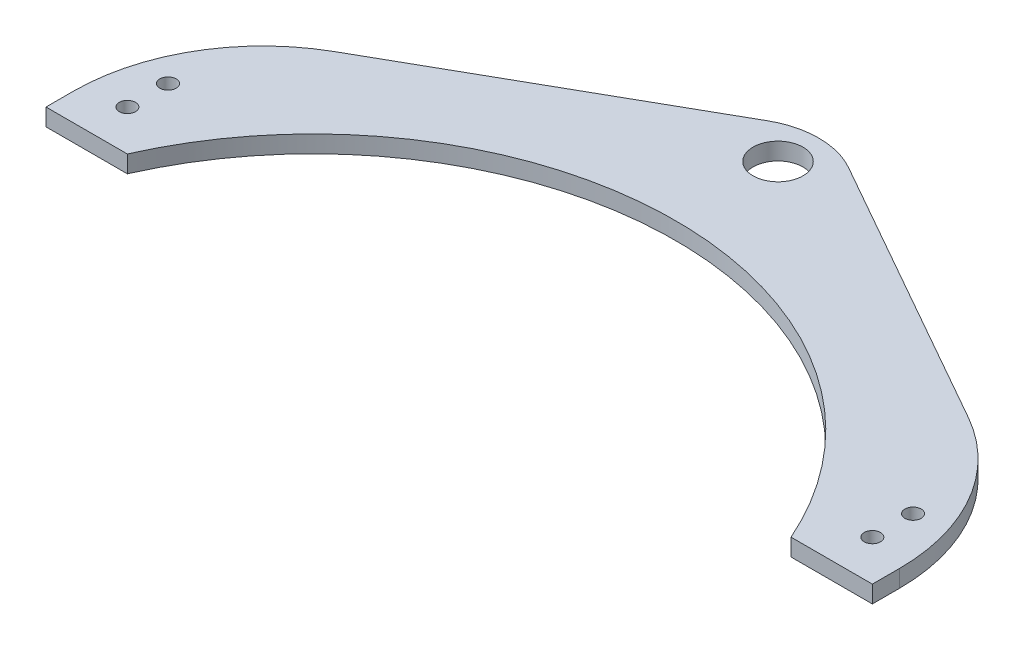
from build123d import *

# Parameters (mm, degrees)
SKETCH1_R           = 4.6
SKETCH1_R_2         = 1.5
BOSS_EXTRUDE2_DEPTH = 3.175


with BuildPart() as part:
    # Sketch1 → Boss-Extrude2 (new body)
    with BuildSketch(Plane(origin=(0, 0, 0), x_dir=(1, 0, 0), z_dir=(0, 1, 0))):
        with BuildLine():
            Line((-7.5, 0), (0, 0))
            ThreePointArc((0, 0), (61.2, 39.907584028), (122.4, 0))
            Line((122.4, 0), (129.9, 0))
            Line((129.9, 0), (137.4, 0))
            Line((137.4, 0), (137.4, 5.001196831))
            ThreePointArc((137.4, 5.001196831), (132.638976527, 22.625166265), (119.651182936, 35.45438529))
            Line((119.651182936, 35.45438529), (68.639886063, 64.351366482))
            ThreePointArc((68.639886063, 64.351366482), (65.069446402, 65.804662996), (61.246521948, 66.3))
            Line((61.246521948, 66.3), (61.153478052, 66.3))
            ThreePointArc((61.153478052, 66.3), (57.330553598, 65.804662996), (53.760113937, 64.351366482))
            Line((53.760113937, 64.351366482), (2.748817064, 35.45438529))
            ThreePointArc((2.748817064, 35.45438529), (-10.238976527, 22.625166265), (-15, 5.001196831))
            Line((-15, 5.001196831), (-15, 0))
            Line((-15, 0), (-7.5, 0))
        make_face()
        with Locations((61.2, 58.8)):
            Circle(SKETCH1_R, mode=Mode.SUBTRACT)
        with BuildLine():
            ThreePointArc((-7.5, 6), (-9, 7.5), (-7.5, 9))
            ThreePointArc((-7.5, 9), (-6, 7.5), (-7.5, 6))
        make_face(mode=Mode.SUBTRACT)
        with Locations((-7.5, 15)):
            Circle(SKETCH1_R_2, mode=Mode.SUBTRACT)
        with BuildLine():
            ThreePointArc((129.9, 6), (128.4, 7.5), (129.9, 9))
            ThreePointArc((129.9, 9), (131.4, 7.5), (129.9, 6))
        make_face(mode=Mode.SUBTRACT)
        with Locations((129.9, 15)):
            Circle(SKETCH1_R_2, mode=Mode.SUBTRACT)
    extrude(amount=BOSS_EXTRUDE2_DEPTH)


solid = part.part
